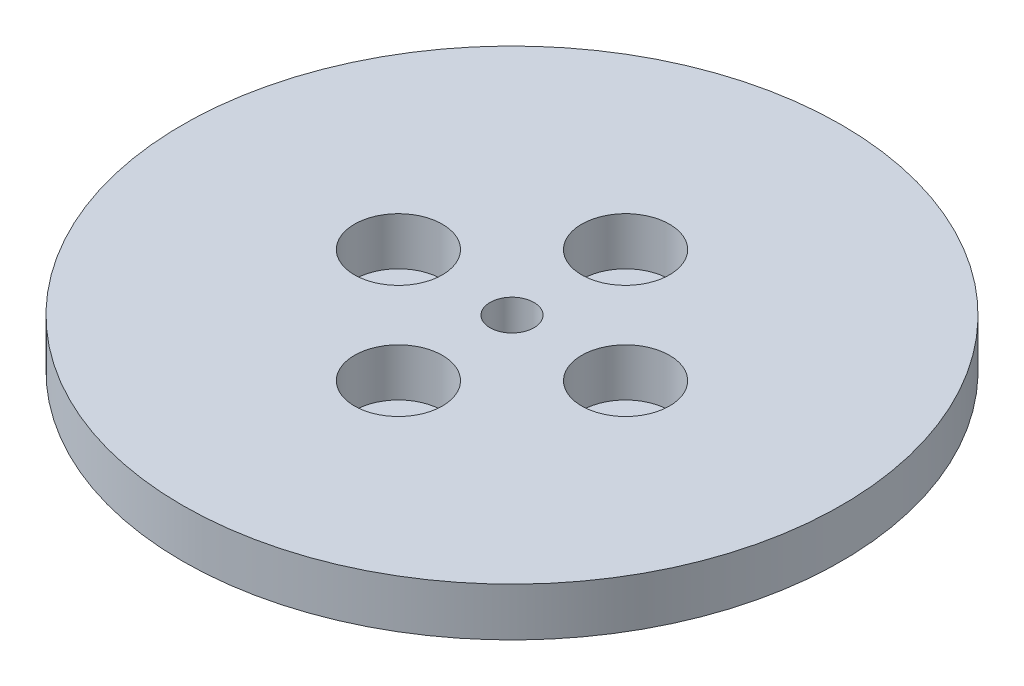
from build123d import *

# Parameters (mm, degrees)
SKETCH1_R           = 75
BOSS_EXTRUDE1_DEPTH = 11
SKETCH2_R           = 5
CUT_EXTRUDE1_DEPTH  = 107.6348911
SKETCH3_R           = 10
CUT_EXTRUDE2_DEPTH  = 10.873176466
CIRPATTERN1_COUNT   = 4


with BuildPart() as part:
    # Sketch1 → Boss-Extrude1 (new body)
    with BuildSketch(Plane(origin=(0, 0, 0), x_dir=(1, 0, 0), z_dir=(0, 1, 0))):
        Circle(SKETCH1_R)
    extrude(amount=BOSS_EXTRUDE1_DEPTH)

    # Sketch2 → Cut-Extrude1 (cut, through all)
    with BuildSketch(Plane(origin=(0, 0, 0), x_dir=(1, 0, 0), z_dir=(0, 1, 0))):
        Circle(SKETCH2_R)
    extrude(amount=CUT_EXTRUDE1_DEPTH, mode=Mode.SUBTRACT)

    # Sketch3 → Cut-Extrude2 (cut)
    with BuildSketch(Plane(origin=(0, 11, 0), x_dir=(1, 0, 0), z_dir=(0, 1, 0))):
        with Locations((-25.848701231, 0)):
            Circle(SKETCH3_R)
    cut_extrude2 = extrude(amount=-CUT_EXTRUDE2_DEPTH, mode=Mode.SUBTRACT)

    # CirPattern1: Cut-Extrude2 ×4 about axis
    cirpattern1_axis = Axis((0, 0, 0), (0, 1, 0))
    for i in range(1, CIRPATTERN1_COUNT):
        add(cut_extrude2.rotate(cirpattern1_axis, i * 360 / CIRPATTERN1_COUNT), mode=Mode.SUBTRACT)


solid = part.part
